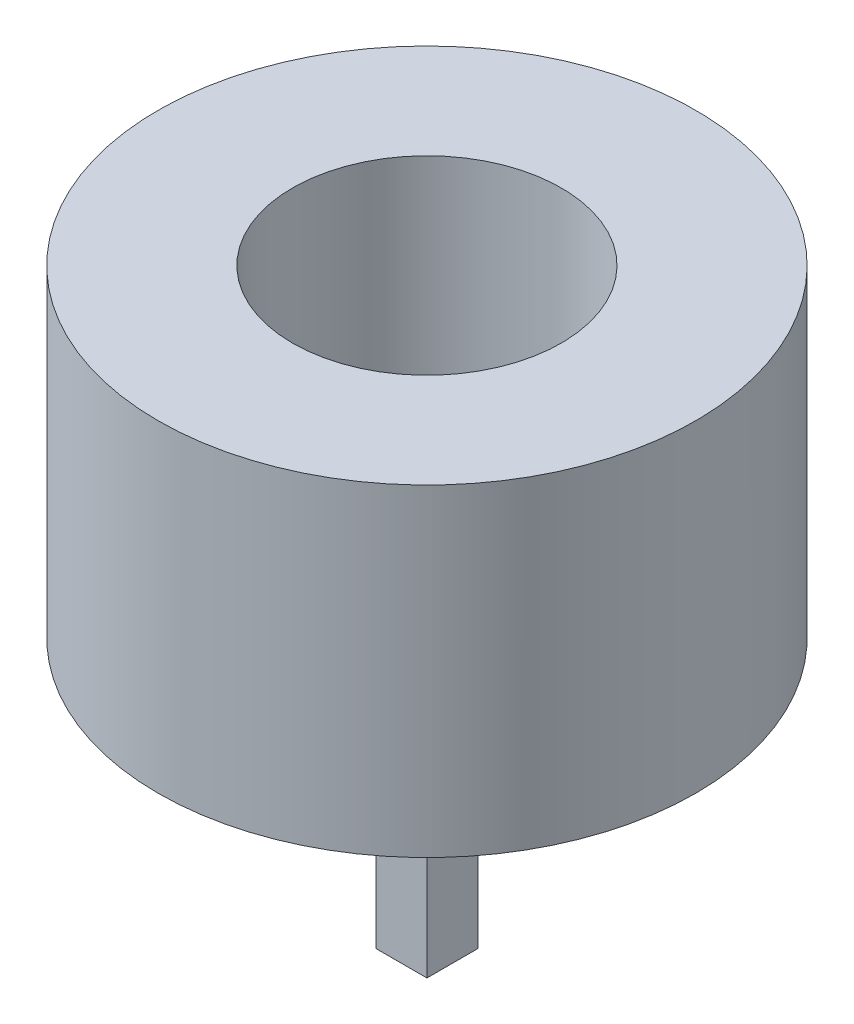
from build123d import *

# Parameters (mm, degrees)
BOSS_EXTRUDE1_DEPTH      = 3
BOSS_EXTRUDE1_DEPTH_BACK = 2
SKETCH1_R                = 5
SKETCH1_R_2              = 2.5
SKETCH2_R                = 5
BOSS_EXTRUDE2_DEPTH      = 1
SKETCH3_W                = 0.95
SKETCH3_H                = 0.95
BOSS_EXTRUDE3_DEPTH      = 5


with BuildPart() as part:
    # Sketch1 → Boss-Extrude1 (new, two sides: drawn at the far end of the back side and taken through both)
    with BuildSketch(Plane(origin=(0, 0, 0), x_dir=(1, 0, 0), z_dir=(0, 1, 0)).offset(-BOSS_EXTRUDE1_DEPTH_BACK)):
        Circle(SKETCH1_R)
        Circle(SKETCH1_R_2, mode=Mode.SUBTRACT)
    extrude(amount=BOSS_EXTRUDE1_DEPTH + BOSS_EXTRUDE1_DEPTH_BACK)

    # Sketch2 → Boss-Extrude2 (add)
    with BuildSketch(Plane.XZ.offset(2)):
        Circle(SKETCH2_R)
    extrude(amount=BOSS_EXTRUDE2_DEPTH)

    # Sketch3 → Boss-Extrude3 (add)
    with BuildSketch(Plane.XZ.offset(3)):
        Rectangle(SKETCH3_W, SKETCH3_H)
    extrude(amount=BOSS_EXTRUDE3_DEPTH)


solid = part.part
